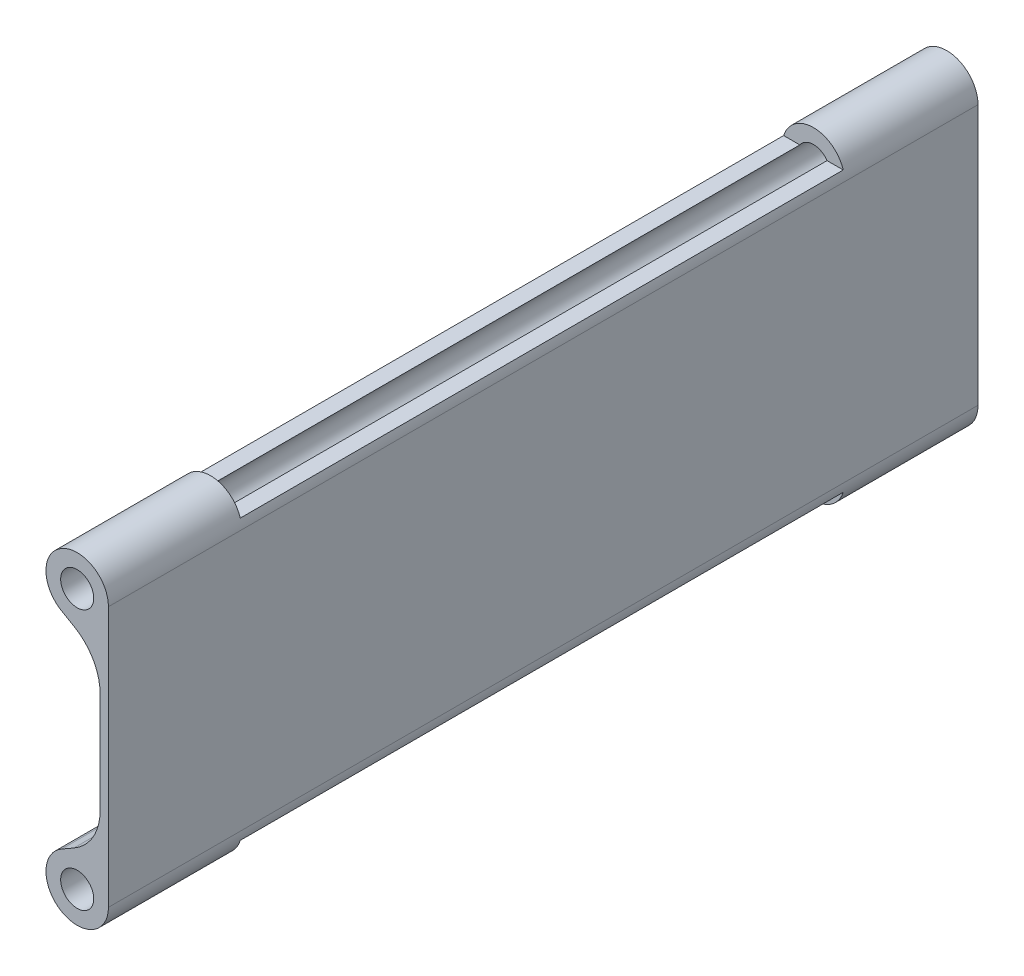
from build123d import *

# Parameters (mm, degrees)
CROQUIS1_R              = 3.175
SALIENTE_EXTRUIR1_DEPTH = 167
REDONDEO1_R             = 10
CROQUIS3_W              = 115.791812306
CROQUIS3_H              = 18.145434914
CORTAR_EXTRUIR2_DEPTH   = 171.276246141


with BuildPart() as part:
    # Croquis1 → Saliente-Extruir1 (new body)
    with BuildSketch(Plane.XY):
        with BuildLine():
            Line((-1.6, 15.556228096), (-8.98691391, 19.796314259))
            ThreePointArc((-8.98691391, 19.796314259), (-9.006535925, 30.19237342), (0, 25))
            Line((0, 25), (0, -25))
            ThreePointArc((0, -25), (-9.006535925, -30.19237342), (-8.98691391, -19.796314259))
            Line((-8.98691391, -19.796314259), (-1.6, -15.556228096))
            Line((-1.6, -15.556228096), (-1.6, 15.556228096))
        make_face()
        with Locations((-6, 25)):
            Circle(CROQUIS1_R, mode=Mode.SUBTRACT)
        with Locations((-6, -25)):
            Circle(CROQUIS1_R, mode=Mode.SUBTRACT)
    extrude(amount=-SALIENTE_EXTRUIR1_DEPTH)

    # Redondeo1
    redondeo1_edges = [part.edges().sort_by_distance(p)[0] for p in [
        (-1.6, -15.556228096, -83.5),
        (-1.6, 15.556228096, -83.5),
    ]]
    fillet(redondeo1_edges, radius=REDONDEO1_R)

    # Croquis3 → Cortar-Extruir2 (cut, through all)
    with BuildSketch(Plane(origin=(0, 0, 0), x_dir=(0, 0, -1), z_dir=(1, 0, 0))):
        with Locations((83.5, 35.875128035)):
            Rectangle(CROQUIS3_W, CROQUIS3_H)
        with Locations((83.5, -35.875128035)):
            Rectangle(CROQUIS3_W, CROQUIS3_H)
    extrude(amount=-CORTAR_EXTRUIR2_DEPTH, mode=Mode.SUBTRACT)


solid = part.part
